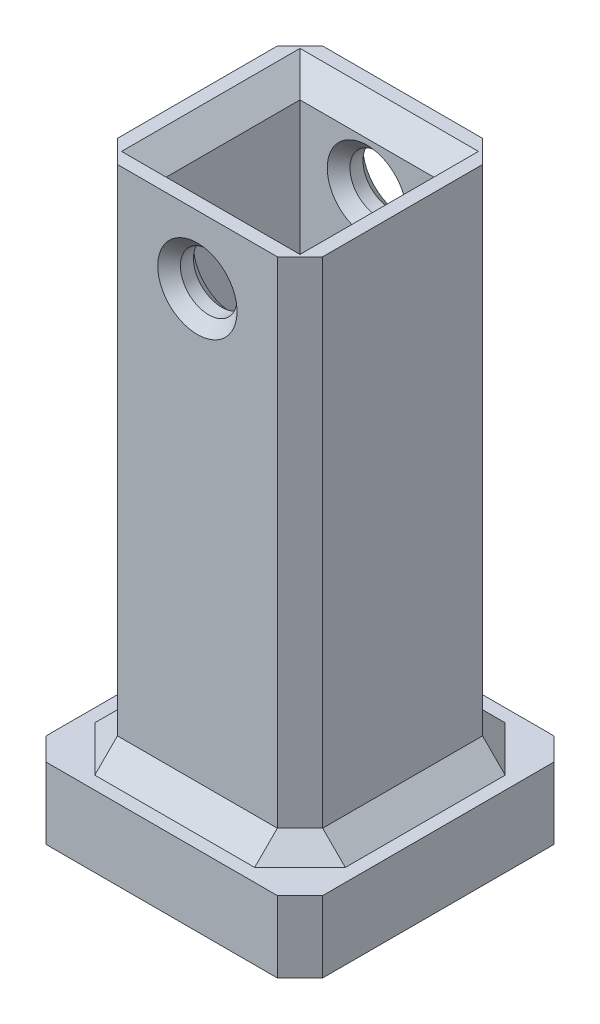
from build123d import *

# Parameters (mm, degrees)
SKETCH1_W           = 23
SKETCH1_H           = 23
SKETCH1_W_2         = 15
SKETCH1_H_2         = 15
BOSS_EXTRUDE1_DEPTH = 66
CHAMFER1_SIZE       = 2.5
SKETCH3_W           = 31
SKETCH3_H           = 31
SKETCH3_W_2         = 23
SKETCH3_H_2         = 23
BOSS_EXTRUDE2_DEPTH = 8
SKETCH4_R           = 3.175
CUT_EXTRUDE1_DEPTH  = 73.974310548
CHAMFER2_SIZE       = 1.27
CHAMFER3_SIZE       = 2.54


with BuildPart() as part:
    # Sketch1 → Boss-Extrude1 (new body)
    with BuildSketch(Plane(origin=(0, 0, 0), x_dir=(1, 0, 0), z_dir=(0, 1, 0))):
        Rectangle(SKETCH1_W, SKETCH1_H)
        Rectangle(SKETCH1_W_2, SKETCH1_H_2, mode=Mode.SUBTRACT)
    extrude(amount=BOSS_EXTRUDE1_DEPTH)

    # Chamfer1
    chamfer1_edges = [part.edges().sort_by_distance(p)[0] for p in [
        (0, 66, -7.5),
        (-7.5, 66, 0),
        (0, 66, 7.5),
        (7.5, 66, 0),
    ]]
    chamfer(chamfer1_edges, length=CHAMFER1_SIZE)

    # Sketch3 → Boss-Extrude2 (add)
    with BuildSketch(Plane.XZ):
        Rectangle(SKETCH3_W, SKETCH3_H)
        Rectangle(SKETCH3_W_2, SKETCH3_H_2, mode=Mode.SUBTRACT)
    extrude(amount=-BOSS_EXTRUDE2_DEPTH)

    # Sketch4 → Cut-Extrude1 (cut, through all)
    with BuildSketch(Plane.XY.offset(11.5)):
        with Locations((0, 58.42)):
            Circle(SKETCH4_R)
    extrude(amount=-CUT_EXTRUDE1_DEPTH, mode=Mode.SUBTRACT)

    # Chamfer2
    chamfer2_edges = [part.edges().sort_by_distance(p)[0] for p in [
        (-3.175, 58.42, -11.5),
        (-3.175, 58.42, -7.5),
        (-3.175, 58.42, 7.5),
        (-3.175, 58.42, 11.5),
    ]]
    chamfer(chamfer2_edges, length=CHAMFER2_SIZE)

    # Chamfer3
    chamfer3_edges = [part.edges().sort_by_distance(p)[0] for p in [
        (-11.5, 37, -11.5),
        (11.5, 37, -11.5),
        (11.5, 37, 11.5),
        (-11.5, 37, 11.5),
        (-11.5, 8, 0),
        (11.5, 8, 0),
        (-15.5, 4, -15.5),
        (15.5, 4, -15.5),
        (15.5, 4, 15.5),
        (-15.5, 4, 15.5),
        (0, 8, -11.5),
        (0, 8, 11.5),
    ]]
    chamfer(chamfer3_edges, length=CHAMFER3_SIZE)


solid = part.part
